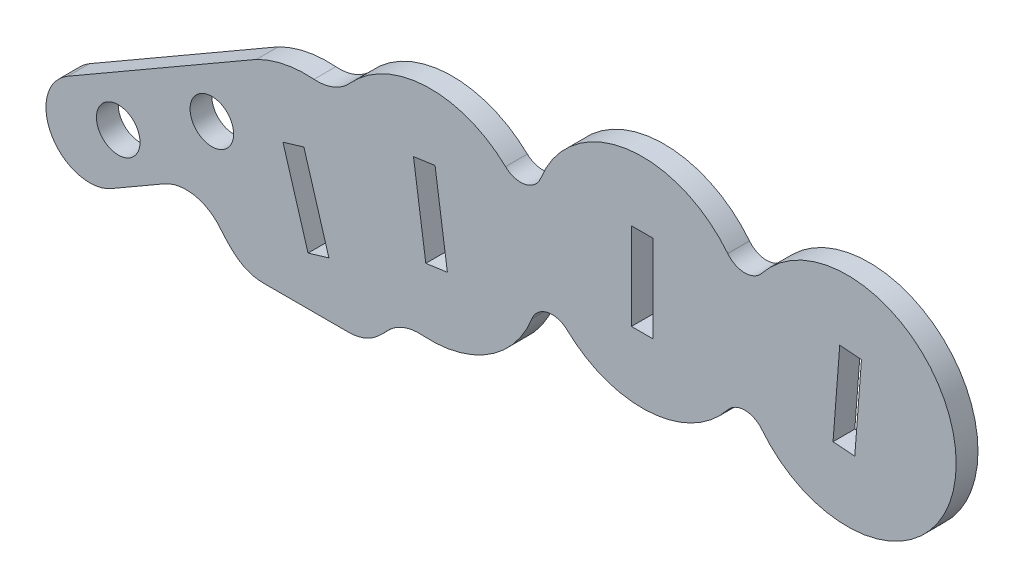
from build123d import *

# Parameters (mm, degrees)
BOSS_EXTRUDE1_OUTLINE_R = 1.5875
BOSS_EXTRUDE1_OUTLINE_W = 1.5875
BOSS_EXTRUDE1_OUTLINE_H = 6.35
BOSS_EXTRUDE1_DEPTH     = 1.5875
FILLET1_R               = 3.175


# Read off the part's stored shape, not the designer's step: Boss-Extrude1
with BuildPart() as part:
    # Boss-Extrude1 outline → Boss-Extrude1 (new body)
    with BuildSketch(Plane.XY):
        with BuildLine():
            ThreePointArc((142.057282468, 6.553787305), (156.214269946, 11.485509293), (142.057282468, 16.417231281))
            ThreePointArc((142.057282468, 16.417231281), (140.813384973, 15.816075679), (139.569487477, 16.417231281))
            ThreePointArc((139.569487477, 16.417231281), (132.172803886, 19.335230024), (125.957459481, 14.375881403))
            ThreePointArc((125.957459481, 14.375881403), (124.82332848, 13.404258866), (123.384428498, 13.804096739))
            ThreePointArc((123.384428498, 13.804096739), (116.794815058, 15.913313858), (111.053922915, 12.051454261))
            ThreePointArc((111.053922915, 12.051454261), (108.094534878, 12.329767665), (105.240273774, 11.499930657))
            Line((105.240273774, 11.499930657), (91.492120489, 3.562430657))
            ThreePointArc((91.492120489, 3.562430657), (90.329989832, -0.7747), (94.667120489, -1.936830657))
            Line((94.667120489, -1.936830657), (101.318750253, 1.903489577))
            ThreePointArc((101.318750253, 1.903489577), (102.647339692, -0.532407494), (104.733149805, -2.3622))
            Line((104.733149805, -2.3622), (112.955202512, -2.3622))
            ThreePointArc((112.955202512, -2.3622), (114.503673459, -1.137682555), (115.702067342, 0.431093193))
            ThreePointArc((115.702067342, 0.431093193), (121.421294864, 0.935289323), (125.304354616, 5.164429205))
            ThreePointArc((125.304354616, 5.164429205), (126.438485618, 6.136051741), (127.8773856, 5.736213868))
            ThreePointArc((127.8773856, 5.736213868), (133.903679898, 3.567343797), (139.569487477, 6.553787305))
            ThreePointArc((139.569487477, 6.553787305), (140.813384973, 7.154942907), (142.057282468, 6.553787305))
        make_face()
        with Locations((95.169339789, 2.0193)):
            Circle(BOSS_EXTRUDE1_OUTLINE_R, mode=Mode.SUBTRACT)
        with Locations((101.988423818, 5.9563)):
            Circle(BOSS_EXTRUDE1_OUTLINE_R, mode=Mode.SUBTRACT)
        Polygon((110.516780309, 1.614730068), (108.996231081, 1.158565299), (107.171572008, 7.24076221), (108.692121236, 7.696926979), align=None, mode=Mode.SUBTRACT)
        Polygon((118.248573702, 11.310144159), (119.146599315, 5.023964874), (117.575054493, 4.799458471), (116.677028881, 11.085637756), align=None, mode=Mode.SUBTRACT)
        with Locations((133.35, 11.485509293)):
            Rectangle(BOSS_EXTRUDE1_OUTLINE_W, BOSS_EXTRUDE1_OUTLINE_H, mode=Mode.SUBTRACT)
        Polygon((149.311693327, 14.590279439), (148.82467056, 8.258983456), (147.241846564, 8.380739148), (147.728869332, 14.71203513), align=None, mode=Mode.SUBTRACT)
    extrude(amount=BOSS_EXTRUDE1_DEPTH)

    # Fillet1
    fillet1_edges = [part.edges().sort_by_distance(p)[0] for p in [
        (115.702067342, 0.431093193, 0.79375),
        (112.955202512, -2.3622, 0.79375),
        (104.733149805, -2.3622, 0.79375),
        (101.318750253, 1.903489577, 0.79375),
        (111.053922915, 12.051454261, 0.79375),
    ]]
    fillet(fillet1_edges, radius=FILLET1_R)


solid = part.part
